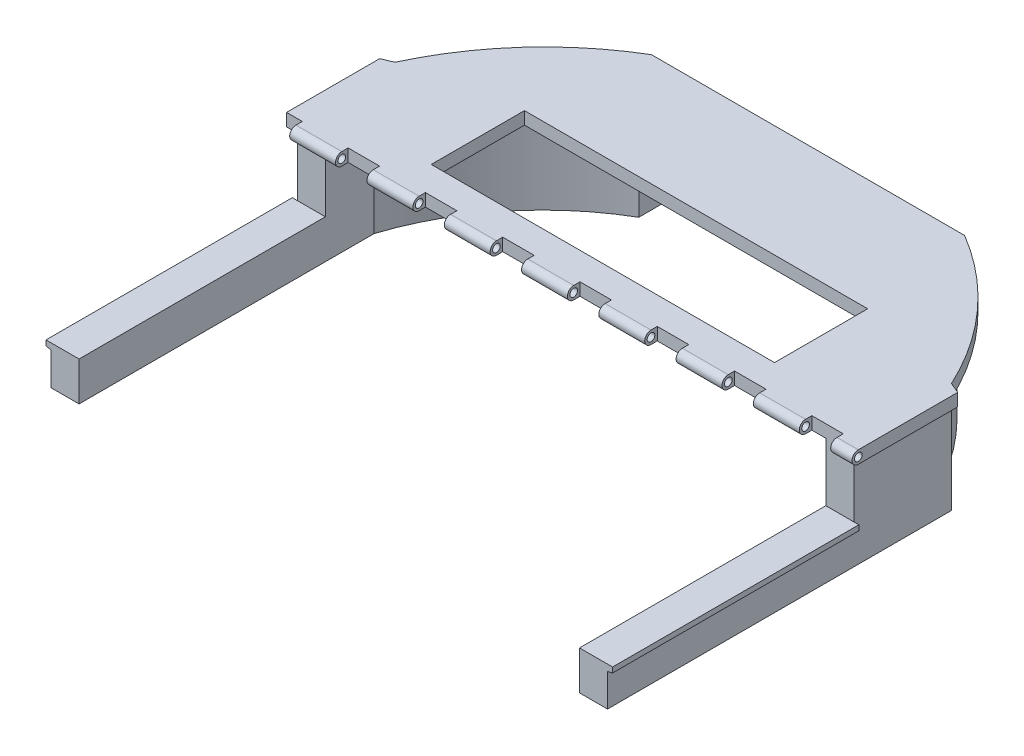
from build123d import *

# Parameters (mm, degrees)
BOSS_EXTRUDE1_DEPTH      = 5.08
BOSS_EXTRUDE2_DEPTH      = 154.427309
BOSS_EXTRUDE2_DEPTH_BACK = 154.427309
SKETCH2_R                = 2.54
SKETCH2_W                = 2.54
SKETCH2_H                = 5.08
SKETCH3_W                = 12.7
SKETCH3_H                = 6.227195603
CUT_EXTRUDE1_DEPTH       = 5.08
BOSS_EXTRUDE3_DEPTH      = 39.37
SKETCH5_W                = 138.751749018
SKETCH5_H                = 37.67744757
CUT_EXTRUDE2_DEPTH       = 5.08
SKETCH6_W                = 11.329576632
SKETCH6_H                = 15.748
BOSS_EXTRUDE4_DEPTH      = 99.568
SKETCH7_W                = 58.494788807
SKETCH7_H                = 56.964758344
CUT_EXTRUDE3_DEPTH       = 5.08
LIP1_START               = -12.594044208
LIP1_DEPTH               = 99.568
LIP2_START               = -12.594044208
LIP2_DEPTH               = 99.568
CUT_EXTRUDE4_REACH       = 261.821
SKETCH8_R                = 1.55


# Read off the part's stored shape, not the designer's step: Lip1, Lip2
with BuildPart() as part:
    # Sketch1 → Boss-Extrude1 (new body)
    with BuildSketch(Plane(origin=(0, 0, 0), x_dir=(1, 0, 0), z_dir=(0, 1, 0))):
        with BuildLine():
            ThreePointArc((-150.649044256, 36.211449361), (-152.994577449, 24.475760888), (-154.427308629, 12.594044208))
            Line((-154.427308629, 12.594044208), (0, 12.594044208))
            Line((0, 12.594044208), (0, 106.558758971))
            Line((0, 106.558758971), (-63.290413745, 106.558758971))
            ThreePointArc((-63.290413745, 106.558758971), (-92.01449877, 83.028775744), (-112.479484736, 52.046240008))
            Line((-112.479484736, 52.046240008), (-150.649044256, 36.211449361))
        make_face()
        with BuildLine():
            Line((0, 106.558758971), (0, 12.594044208))
            Line((0, 12.594044208), (154.427308629, 12.594044208))
            ThreePointArc((154.427308629, 12.594044208), (152.994577449, 24.475760888), (150.649044256, 36.211449361))
            Line((150.649044256, 36.211449361), (112.479484736, 52.046240008))
            ThreePointArc((112.479484736, 52.046240008), (92.01449877, 83.028775744), (63.290413745, 106.558758971))
            Line((63.290413745, 106.558758971), (0, 106.558758971))
        make_face()
    extrude(amount=BOSS_EXTRUDE1_DEPTH)

    # Sketch2 → Boss-Extrude2 (add, two sides: drawn at the far end of the back side and taken through both)
    with BuildSketch(Plane(origin=(0, 0, 0), x_dir=(0, 0, -1), z_dir=(1, 0, 0)).offset(-BOSS_EXTRUDE2_DEPTH_BACK)):
        with Locations((10.054044208, 2.54)):
            Circle(SKETCH2_R)
        with Locations((11.324044208, 2.54)):
            Rectangle(SKETCH2_W, SKETCH2_H)
    extrude(amount=BOSS_EXTRUDE2_DEPTH + BOSS_EXTRUDE2_DEPTH_BACK)

    # Sketch3 → Cut-Extrude1 (cut)
    with BuildSketch(Plane(origin=(0, 5.08, 0), x_dir=(1, 0, 0), z_dir=(0, 1, 0))):
        with Locations((-116.835308629, 9.480446407)):
            Rectangle(SKETCH3_W, SKETCH3_H)
        with Locations((-148.077308629, 9.480446407)):
            Rectangle(SKETCH3_W, SKETCH3_H)
        with Locations((-85.593308629, 9.480446407)):
            Rectangle(SKETCH3_W, SKETCH3_H)
        with Locations((-54.351308629, 9.480446407)):
            Rectangle(SKETCH3_W, SKETCH3_H)
        with Locations((-23.109308629, 9.480446407)):
            Rectangle(SKETCH3_W, SKETCH3_H)
        with Locations((8.132691371, 9.480446407)):
            Rectangle(SKETCH3_W, SKETCH3_H)
        with Locations((39.374691371, 9.480446407)):
            Rectangle(SKETCH3_W, SKETCH3_H)
        with Locations((70.616691371, 9.480446407)):
            Rectangle(SKETCH3_W, SKETCH3_H)
        with Locations((101.858691371, 9.480446407)):
            Rectangle(SKETCH3_W, SKETCH3_H)
        with Locations((133.100691371, 9.480446407)):
            Rectangle(SKETCH3_W, SKETCH3_H)
    extrude(amount=-CUT_EXTRUDE1_DEPTH, mode=Mode.SUBTRACT)

    # Sketch4 → Boss-Extrude3 (add)
    with BuildSketch(Plane.XZ):
        with BuildLine():
            Line((-53.354740134, -106.481309786), (-53.354740134, -91.517526844))
            ThreePointArc((-53.354740134, -91.517526844), (-82.728496733, -66.340222196), (-101.149908104, -32.320142108))
            Line((-101.149908104, -32.320142108), (-101.149908104, -52.046240008))
            Line((-101.149908104, -52.046240008), (-112.479484736, -52.046240008))
            Line((-112.479484736, -52.046240008), (-100.285956923, -61.644665115))
            ThreePointArc((-100.285956923, -61.644665115), (-80.038963099, -87.43196163), (-53.354740134, -106.481309786))
        make_face()
        Polygon((-101.149908104, -52.046240008), (-101.149908104, -32.320142108), (-101.149908104, -12.594044208), (-110.485308629, -12.594044208), (-112.479484736, -12.594044208), (-112.479484736, -52.046240008), align=None)
        with BuildLine():
            Line((99.574939951, -61.644665115), (112.479484736, -52.046240008))
            Line((112.479484736, -52.046240008), (101.149908104, -52.046240008))
            Line((101.149908104, -52.046240008), (101.149908104, -32.320142108))
            ThreePointArc((101.149908104, -32.320142108), (82.470268628, -66.658795409), (52.643723162, -91.92634826))
            Line((52.643723162, -91.92634826), (52.643723162, -106.481309786))
            ThreePointArc((52.643723162, -106.481309786), (79.327946127, -87.43196163), (99.574939951, -61.644665115))
        make_face()
        Polygon((112.479484736, -52.046240008), (112.479484736, -12.594044208), (108.208691371, -12.594044208), (101.149908104, -12.594044208), (101.149908104, -32.320142108), (101.149908104, -52.046240008), align=None)
    extrude(amount=BOSS_EXTRUDE3_DEPTH)

    # Sketch5 → Cut-Extrude2 (cut)
    with BuildSketch(Plane.XZ):
        with Locations((0, -42.458273938)):
            Rectangle(SKETCH5_W, SKETCH5_H)
    extrude(amount=-CUT_EXTRUDE2_DEPTH, mode=Mode.SUBTRACT)

    # Sketch6 → Boss-Extrude4 (add)
    with BuildSketch(Plane.XY.offset(-12.594044208)):
        with Locations((-106.81469642, -31.496)):
            Rectangle(SKETCH6_W, SKETCH6_H)
        with Locations((106.81469642, -31.496)):
            Rectangle(SKETCH6_W, SKETCH6_H)
    extrude(amount=BOSS_EXTRUDE4_DEPTH)

    # Sketch7 → Cut-Extrude3 (cut)
    with BuildSketch(Plane(origin=(0, 5.08, 0), x_dir=(1, 0, 0), z_dir=(0, 1, 0))):
        with Locations((-146.082703033, 21.756830304)):
            Rectangle(SKETCH7_W, SKETCH7_H)
        with Locations((146.082703033, 21.756830304)):
            Rectangle(SKETCH7_W, SKETCH7_H)
    extrude(amount=-CUT_EXTRUDE3_DEPTH, mode=Mode.SUBTRACT)

    # Lip1 outline → Lip1 (add)
    with BuildSketch(Plane.XY.offset(LIP1_START)):
        Polygon((-112.479484736, -23.622), (-114.511484736, -23.622), (-114.511484736, -25.730085067), (-112.479484736, -26.162), align=None)
    extrude(amount=LIP1_DEPTH)

    # Lip2 outline → Lip2 (add)
    with BuildSketch(Plane.XY.offset(LIP2_START)):
        Polygon((114.511484736, -23.622), (112.479484736, -23.622), (112.479484736, -26.162), (114.511484736, -25.730085067), align=None)
    extrude(amount=LIP2_DEPTH)

    # Cut-Extrude4: up to this face of the body (flat: up to its plane)
    cut_extrude4_end = Plane(part.part.faces().sort_by_distance((-116.835308629, 2.54, -31.416626842))[0])
    # Sketch8 → Cut-Extrude4 (cut, up to the picked face)
    with BuildSketch(Plane(origin=(116.835308629, 0, 0), x_dir=(0, 0, -1), z_dir=(1, 0, 0)), mode=Mode.PRIVATE) as cut_extrude4_sk1:
        with Locations((10.054044208, 2.54)):
            Circle(SKETCH8_R)
    cut_extrude4_tool1 = split(extrude(cut_extrude4_sk1.sketch, amount=-CUT_EXTRUDE4_REACH, mode=Mode.PRIVATE), bisect_by=cut_extrude4_end, keep=Keep.BOTH, mode=Mode.PRIVATE)
    add(cut_extrude4_tool1.solids().sort_by(Axis((116.835309, 2.54, -10.054044), (-1, 0, 0)))[0], mode=Mode.SUBTRACT)


solid = part.part
